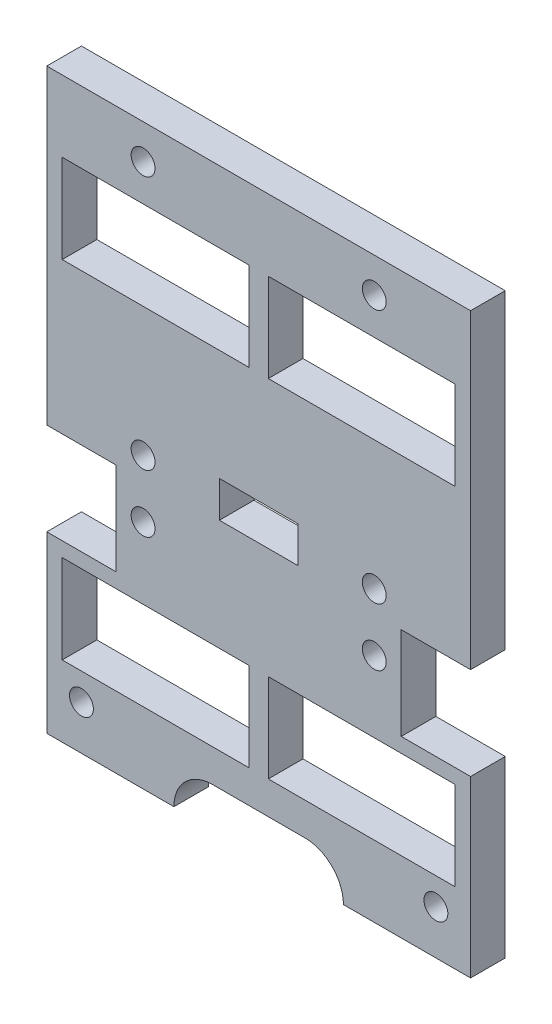
from build123d import *

# Parameters (mm, degrees)
SKETCH1_W                 = 55
SKETCH1_H                 = 75
SKETCH1_W_2               = 24.25
SKETCH1_H_2               = 11.5
BOSS_EXTRUDE1_DEPTH       = 4.5
SKETCH2_R                 = 1.55
SCREWHOLES_DEPTH          = 47.719910103
SKETCH4_W                 = 10.2
SKETCH4_H                 = 4.7
MOUNTINGPLATETAB_DEPTH    = 47.719910103
SKETCH5_R                 = 1.55
SKETCH5_W                 = 4.7
SKETCH5_H                 = 10.2
BRACETABS_DEPTH           = 47.719910103
SKETCH8_R                 = 1.55
EXPANSIONSCREWHOLES_DEPTH = 47.719910103
SKETCH11_W                = 18
SKETCH11_H                = 12
CUT_EXTRUDE2_DEPTH        = 47.719910103
REARFANSLOT_DEPTH         = 47.719910103


with BuildPart() as part:
    # Sketch1 → Boss-Extrude1 (new body)
    with BuildSketch(Plane.XY):
        Rectangle(SKETCH1_W, SKETCH1_H)
        with Locations((-13.375, 22.5)):
            Rectangle(SKETCH1_W_2, SKETCH1_H_2, mode=Mode.SUBTRACT)
        with Locations((13.375, 22.5)):
            Rectangle(SKETCH1_W_2, SKETCH1_H_2, mode=Mode.SUBTRACT)
        with Locations((13.375, -22.5)):
            Rectangle(SKETCH1_W_2, SKETCH1_H_2, mode=Mode.SUBTRACT)
        with Locations((-13.375, -22.5)):
            Rectangle(SKETCH1_W_2, SKETCH1_H_2, mode=Mode.SUBTRACT)
    extrude(amount=BOSS_EXTRUDE1_DEPTH)

    # Sketch2 → screwHoles (cut, through all)
    with BuildSketch(Plane.XY.offset(4.5)):
        with Locations((-15, 33)):
            Circle(SKETCH2_R)
        with Locations((15, 33)):
            Circle(SKETCH2_R)
        with Locations((15, 0)):
            Circle(SKETCH2_R)
        with Locations((-15, 0)):
            Circle(SKETCH2_R)
    extrude(amount=-SCREWHOLES_DEPTH, mode=Mode.SUBTRACT)

    # Sketch4 → mountingPlateTab (cut, through all)
    with BuildSketch(Plane.XY.offset(4.5)):
        Rectangle(SKETCH4_W, SKETCH4_H)
    extrude(amount=-MOUNTINGPLATETAB_DEPTH, mode=Mode.SUBTRACT)

    # Sketch5 → BraceTabs (cut, through all)
    with BuildSketch(Plane.XY.offset(4.5)):
        with Locations((23, -31.75)):
            Circle(SKETCH5_R)
        with Locations((-23, -31.75)):
            Circle(SKETCH5_R)
        with Locations((23, -9.75)):
            Rectangle(SKETCH5_W, SKETCH5_H)
        with Locations((-23, -9.75)):
            Rectangle(SKETCH5_W, SKETCH5_H)
    extrude(amount=-BRACETABS_DEPTH, mode=Mode.SUBTRACT)

    # Sketch8 → ExpansionScrewholes (cut, through all)
    with BuildSketch(Plane.XY.offset(4.5)):
        with Locations((-15, -7.5)):
            Circle(SKETCH8_R)
        with Locations((15, -7.5)):
            Circle(SKETCH8_R)
    extrude(amount=-EXPANSIONSCREWHOLES_DEPTH, mode=Mode.SUBTRACT)

    # Sketch11 → Cut-Extrude2 (cut, through all)
    with BuildSketch(Plane.XY.offset(4.5)):
        with Locations((27.5, -8.85)):
            Rectangle(SKETCH11_W, SKETCH11_H)
        with Locations((-27.5, -8.85)):
            Rectangle(SKETCH11_W, SKETCH11_H)
    extrude(amount=-CUT_EXTRUDE2_DEPTH, mode=Mode.SUBTRACT)

    # Sketch9 → RearFanSlot (cut, through all)
    with BuildSketch(Plane.XY.offset(4.5)):
        with BuildLine():
            Line((-6, -32.5), (6, -32.5))
            ThreePointArc((6, -32.5), (11, -37.5), (6, -42.5))
            Line((6, -42.5), (-6, -42.5))
            ThreePointArc((-6, -42.5), (-11, -37.5), (-6, -32.5))
        make_face()
    extrude(amount=-REARFANSLOT_DEPTH, mode=Mode.SUBTRACT)


solid = part.part
